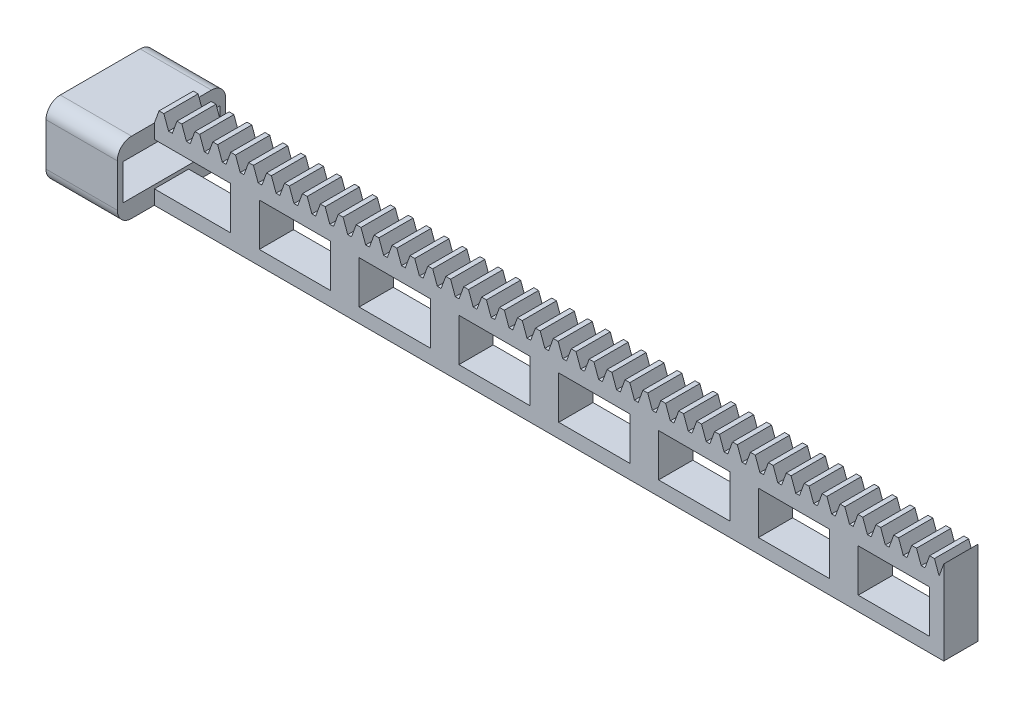
from build123d import *

# Parameters (mm, degrees)
SKETCH_1_W               = 125.663706144
SKETCH_1_H               = 10
EXTRUDE_1_DEPTH          = 30
EXTRUDE_2_DEPTH          = 30
PATTERN_LINEAR_1_COUNT   = 20
PATTERN_LINEAR_1_PITCH   = 6.283185307
CUT_EXTRUDE_1_DEPTH      = 22
CUT_EXTRUDE_2_REACH      = 128.315
CUT_EXTRUDE_3_REACH      = 246.059
CUT_EXTRUDE_6_REACH      = 484.653
SKETCH_7_W               = 207.345115137
SKETCH_7_H               = 14.578468588
CUT_EXTRUDE_7_REACH      = 552.426
SKETCH_9_W               = 278.972656916
SKETCH_9_H               = 19.040254303
SKETCH_10_W              = 8
SKETCH_10_H              = 15
EXTRUDE_1_2_DEPTH        = 276.776278088
SKETCH_11_W              = 38
SKETCH_11_H              = 25
SKETCH_11_R              = 1.25
EXTRUDE_2_2_DEPTH        = 25
CUT_EXTRUDE_9_DEPTH      = 279.853201725
CUT_EXTRUDE_9_DEPTH_BACK = 279.853201725
SKETCH_12_W              = 25
SKETCH_12_H              = 15
CUT_EXTRUDE_10_REACH     = 280.853
SKETCH_13_W              = 1.776278088
SKETCH_13_H              = 15
SKETCH_14_W              = 34
SKETCH_14_H              = 12.5
CUT_EXTRUDE_11_DEPTH     = 20
CUT_EXTRUDE_12_REACH     = 305.682
SKETCH_15_W              = 23.5
SKETCH_15_H              = 12.5
FILLET_1_R               = 5
SKETCH_20_W              = 25
SKETCH_20_H              = 15
EXTRUDE_5_DEPTH          = 2
EXTRUDE_START            = -8
SKETCH_20_2_W            = 25
SKETCH_20_2_H            = 15
EXTRUDE_6_DEPTH          = 2


with BuildPart() as part:
    # 草图1 → Extrude 1 (new body)
    with BuildSketch(Plane.XY):
        with Locations((62.831853072, -5)):
            Rectangle(SKETCH_1_W, SKETCH_1_H)
    extrude(amount=EXTRUDE_1_DEPTH)

    # 草图2 → Extrude 2 (add)
    with BuildSketch(Plane.XY.offset(30)):
        Polygon((0, 0), (1.637866054, 4.5), (3.323577771, 4.5), (4.961443825, 0), align=None)
    extrude_2 = extrude(amount=-EXTRUDE_2_DEPTH)

    # 阵列(线性)1: Extrude 2 ×20
    with Locations(*[(i * PATTERN_LINEAR_1_PITCH, 0, 0) for i in range(1, PATTERN_LINEAR_1_COUNT)]):
        add(extrude_2)

    # 草图3 → 切除-拉伸1 (cut)
    with BuildSketch(Plane.XY.offset(30)):
        Polygon((0, 0), (0, -10), (125.663706144, -10), (125.663706144, 0), (124.341964661, 0), (122.704098607, 4.5), (121.018386891, 4.5), (119.380520836, 0), (118.058779354, 0), (116.4209133, 4.5), (114.735201583, 4.5), (113.097335529, 0), (111.775594047, 0), (110.137727993, 4.5), (108.452016276, 4.5), (106.814150222, 0), (105.49240874, 0), (103.854542686, 4.5), (102.168830969, 4.5), (100.530964915, 0), (99.209223433, 0), (97.571357378, 4.5), (95.885645662, 4.5), (94.247779608, 0), (92.926038125, 0), (91.288172071, 4.5), (89.602460355, 4.5), (87.964594301, 0), (86.642852818, 0), (85.004986764, 4.5), (83.319275048, 4.5), (81.681408993, 0), (80.359667511, 0), (78.721801457, 4.5), (77.03608974, 4.5), (75.398223686, 0), (74.076482204, 0), (72.43861615, 4.5), (70.752904433, 4.5), (69.115038379, 0), (67.793296897, 0), (66.155430843, 4.5), (64.469719126, 4.5), (62.831853072, 0), (61.51011159, 0), (59.872245535, 4.5), (58.186533819, 4.5), (56.548667765, 0), (55.226926282, 0), (53.589060228, 4.5), (51.903348512, 4.5), (50.265482457, 0), (48.943740975, 0), (47.305874921, 4.5), (45.620163204, 4.5), (43.98229715, 0), (42.660555668, 0), (41.022689614, 4.5), (39.336977897, 4.5), (37.699111843, 0), (36.377370361, 0), (34.739504307, 4.5), (33.05379259, 4.5), (31.415926536, 0), (30.094185054, 0), (28.456318999, 4.5), (26.770607283, 4.5), (25.132741229, 0), (23.810999746, 0), (22.173133692, 4.5), (20.487421976, 4.5), (18.849555922, 0), (17.527814439, 0), (15.889948385, 4.5), (14.204236669, 4.5), (12.566370614, 0), (11.244629132, 0), (9.606763078, 4.5), (7.921051361, 4.5), (6.283185307, 0), (4.961443825, 0), (3.323577771, 4.5), (1.637866054, 4.5), align=None)
    extrude(amount=-CUT_EXTRUDE_1_DEPTH, mode=Mode.SUBTRACT)

    # 草图4 → 切除-拉伸2 (cut, up to next)
    with BuildSketch(Plane(origin=(0, 0, 0), x_dir=(-1, 0, 0), z_dir=(0, 0, -1)), mode=Mode.PRIVATE) as cut_extrude_2_sk1:
        Polygon((-121.861242749, 4.5), (-121.861242749, -10), (-125.663706144, -10), (-125.663706144, 0), (-124.341964661, 0), (-122.704098607, 4.5), align=None)
    cut_extrude_2_tool1 = extrude(cut_extrude_2_sk1.sketch, amount=-CUT_EXTRUDE_2_REACH, mode=Mode.PRIVATE) & part.part
    add(cut_extrude_2_tool1.solids().sort_by_distance((123.597626, -3.869254, 0))[0], mode=Mode.SUBTRACT)

    # 镜向1: part across plane


with BuildPart() as part_1:
    add(part.part)
    add(part.part.mirror(Plane(origin=(121.861242749, 4.5, 8.001025), x_dir=(0, 0, 1), z_dir=(-1, 0, 0))))

    # 草图5 → 切除-拉伸3 (cut, up to next)
    with BuildSketch(Plane(origin=(0, 0, 0), x_dir=(-1, 0, 0), z_dir=(0, 0, -1)), mode=Mode.PRIVATE) as cut_extrude_3_sk1:
        Polygon((-241.241763585, 4.5), (-241.241763585, -10), (-243.722485498, -10), (-243.722485498, 0), (-242.084619444, 4.5), align=None)
    cut_extrude_3_tool1 = extrude(cut_extrude_3_sk1.sketch, amount=-CUT_EXTRUDE_3_REACH, mode=Mode.PRIVATE) & part_1.part
    add(cut_extrude_3_tool1.solids().sort_by_distance((242.402862, -3.406333, 0))[0], mode=Mode.SUBTRACT)

    # 镜向2: part across plane


with BuildPart() as part_2:
    add(part_1.part)
    add(part_1.part.mirror(Plane(origin=(241.241763585, 4.5, 8.001025), x_dir=(0, 0, 1), z_dir=(-1, 0, 0))))

    # 草图7 → 切除-拉伸6 (cut, up to next)
    with BuildSketch(Plane(origin=(0, 0, 0), x_dir=(-1, 0, 0), z_dir=(0, 0, -1)), mode=Mode.PRIVATE) as cut_extrude_6_sk1:
        with Locations((-378.810969602, -2.710765706)):
            Rectangle(SKETCH_7_W, SKETCH_7_H)
    cut_extrude_6_tool1 = extrude(cut_extrude_6_sk1.sketch, amount=-CUT_EXTRUDE_6_REACH, mode=Mode.PRIVATE) & part_2.part
    add(cut_extrude_6_tool1.solids().sort_by_distance((378.81097, -2.710766, 0))[0], mode=Mode.SUBTRACT)

    # 镜向4: part across plane


with BuildPart() as part_3:
    add(part_2.part)
    add(part_2.part.mirror(Plane(origin=(275.138412034, 4.578468588, 8.001025), x_dir=(0, 0, 1), z_dir=(-1, 0, 0))))

    # 草图9 → 切除-拉伸7 (cut, up to next)
    with BuildSketch(Plane(origin=(0, 0, 0), x_dir=(-1, 0, 0), z_dir=(0, 0, -1)), mode=Mode.PRIVATE) as cut_extrude_7_sk1:
        with Locations((-416.262606546, -4.273704806)):
            Rectangle(SKETCH_9_W, SKETCH_9_H)
    cut_extrude_7_tool1 = extrude(cut_extrude_7_sk1.sketch, amount=-CUT_EXTRUDE_7_REACH, mode=Mode.PRIVATE) & part_3.part
    add(cut_extrude_7_tool1.solids().sort_by_distance((416.262607, -4.273705, 0))[0], mode=Mode.SUBTRACT)

    # 草图10 → Extrude 1 2 (add)
    with BuildSketch(Plane.ZY):
        with Locations((4, -17.5)):
            Rectangle(SKETCH_10_W, SKETCH_10_H)
    extrude(amount=-EXTRUDE_1_2_DEPTH)

    # 草图11 → Extrude 2 2 (add)
    with BuildSketch(Plane.ZY):
        with Locations((4, -12.5)):
            Rectangle(SKETCH_11_W, SKETCH_11_H)
        with Locations(Location((-10, -16, 0), (0, 0, 270))):
            Circle(SKETCH_11_R, mode=Mode.SUBTRACT)
        with Locations(Location((-10, -9, 0), (0, 0, 270))):
            Circle(SKETCH_11_R, mode=Mode.SUBTRACT)
        with Locations(Location((18, -9, 0), (0, 0, 270))):
            Circle(SKETCH_11_R, mode=Mode.SUBTRACT)
        with Locations(Location((18, -16, 0), (0, 0, 270))):
            Circle(SKETCH_11_R, mode=Mode.SUBTRACT)
    extrude(amount=EXTRUDE_2_2_DEPTH)

    # 草图12 → 切除-拉伸9 (cut, two sides: drawn at the far end of the back side and taken through both)
    with BuildSketch(Plane(origin=(0, 0, 0), x_dir=(-1, 0, 0), z_dir=(0, 0, -1)).offset(-CUT_EXTRUDE_9_DEPTH_BACK)):
        with Locations((-259.276278088, -12.5)):
            Rectangle(SKETCH_12_W, SKETCH_12_H)
        with Locations((-224.276278088, -12.5)):
            Rectangle(SKETCH_12_W, SKETCH_12_H)
        with Locations((-189.276278088, -12.5)):
            Rectangle(SKETCH_12_W, SKETCH_12_H)
        with Locations((-154.276278088, -12.5)):
            Rectangle(SKETCH_12_W, SKETCH_12_H)
        with Locations((-119.276278088, -12.5)):
            Rectangle(SKETCH_12_W, SKETCH_12_H)
        with Locations((-84.276278088, -12.5)):
            Rectangle(SKETCH_12_W, SKETCH_12_H)
        with Locations((-49.276278088, -12.5)):
            Rectangle(SKETCH_12_W, SKETCH_12_H)
        with Locations((-14.276278088, -12.5)):
            Rectangle(SKETCH_12_W, SKETCH_12_H)
    extrude(amount=CUT_EXTRUDE_9_DEPTH + CUT_EXTRUDE_9_DEPTH_BACK, mode=Mode.SUBTRACT)

    # 草图13 → 切除-拉伸10 (cut, up to next)
    with BuildSketch(Plane(origin=(0, 0, 0), x_dir=(-1, 0, 0), z_dir=(0, 0, -1)), mode=Mode.PRIVATE) as cut_extrude_10_sk1:
        with Locations((-0.888139044, -12.5)):
            Rectangle(SKETCH_13_W, SKETCH_13_H)
    cut_extrude_10_tool1 = extrude(cut_extrude_10_sk1.sketch, amount=-CUT_EXTRUDE_10_REACH, mode=Mode.PRIVATE) & part_3.part
    add(cut_extrude_10_tool1.solids().sort_by_distance((0.888139, -12.5, 0))[0], mode=Mode.SUBTRACT)

    # 草图14 → 切除-拉伸11 (cut)
    with BuildSketch(Plane(origin=(0, 0, 0), x_dir=(0, 0, -1), z_dir=(1, 0, 0))):
        with Locations((-4, -12.5)):
            Rectangle(SKETCH_14_W, SKETCH_14_H)
    extrude(amount=-CUT_EXTRUDE_11_DEPTH, mode=Mode.SUBTRACT)

    # 草图15 → 切除-拉伸12 (cut, up to next)
    with BuildSketch(Plane.ZY.offset(25), mode=Mode.PRIVATE) as cut_extrude_12_sk1:
        with Locations((4, -12.5)):
            Rectangle(SKETCH_15_W, SKETCH_15_H)
    cut_extrude_12_tool1 = extrude(cut_extrude_12_sk1.sketch, amount=-CUT_EXTRUDE_12_REACH, mode=Mode.PRIVATE) & part_3.part
    add(cut_extrude_12_tool1.solids().sort_by_distance((-25, -12.5, 4))[0], mode=Mode.SUBTRACT)

    # 圆角1
    fillet_1_edges = [part_3.edges().sort_by_distance(p)[0] for p in [
        (-12.5, 0, -15),
        (-12.5, -25, -15),
        (-12.5, -25, 23),
        (-12.5, 0, 23),
    ]]
    fillet(fillet_1_edges, radius=FILLET_1_R)

    # 草图20 → 凸台-拉伸5 (add)
    with BuildSketch(Plane(origin=(0, 0, 0), x_dir=(-1, 0, 0), z_dir=(0, 0, -1))):
        Polygon((-26.776278088, -5), (0, -5), (0, 0), (-1.637866054, 4.5), (-3.323577771, 4.5), (-4.961443825, 0), (-6.283185307, 0), (-7.921051361, 4.5), (-9.606763078, 4.5), (-11.244629132, 0), (-12.566370614, 0), (-14.204236669, 4.5), (-15.889948385, 4.5), (-17.527814439, 0), (-18.849555922, 0), (-20.487421976, 4.5), (-22.173133692, 4.5), (-23.810999746, 0), (-25.132741229, 0), (-26.770607283, 4.5), (-28.456318999, 4.5), (-30.094185054, 0), (-31.415926536, 0), (-33.05379259, 4.5), (-34.739504307, 4.5), (-36.377370361, 0), (-37.699111843, 0), (-39.336977897, 4.5), (-41.022689614, 4.5), (-42.660555668, 0), (-43.98229715, 0), (-45.620163204, 4.5), (-47.305874921, 4.5), (-48.943740975, 0), (-50.265482457, 0), (-51.903348512, 4.5), (-53.589060228, 4.5), (-55.226926282, 0), (-56.548667765, 0), (-58.186533819, 4.5), (-59.872245535, 4.5), (-61.51011159, 0), (-62.831853072, 0), (-64.469719126, 4.5), (-66.155430843, 4.5), (-67.793296897, 0), (-69.115038379, 0), (-70.752904433, 4.5), (-72.43861615, 4.5), (-74.076482204, 0), (-75.398223686, 0), (-77.03608974, 4.5), (-78.721801457, 4.5), (-80.359667511, 0), (-81.681408993, 0), (-83.319275048, 4.5), (-85.004986764, 4.5), (-86.642852818, 0), (-87.964594301, 0), (-89.602460355, 4.5), (-91.288172071, 4.5), (-92.926038125, 0), (-94.247779608, 0), (-95.885645662, 4.5), (-97.571357378, 4.5), (-99.209223433, 0), (-100.530964915, 0), (-102.168830969, 4.5), (-103.854542686, 4.5), (-105.49240874, 0), (-106.814150222, 0), (-108.452016276, 4.5), (-110.137727993, 4.5), (-111.775594047, 0), (-113.097335529, 0), (-114.735201583, 4.5), (-116.4209133, 4.5), (-118.058779354, 0), (-119.380520836, 0), (-121.018386891, 4.5), (-122.704098607, 4.5), (-124.341964661, 0), (-125.663706144, 0), (-127.301572198, 4.5), (-128.987283914, 4.5), (-130.625149969, 0), (-131.946891451, 0), (-133.584757505, 4.5), (-135.270469222, 4.5), (-136.908335276, 0), (-138.230076758, 0), (-139.867942812, 4.5), (-141.553654529, 4.5), (-143.191520583, 0), (-144.513262065, 0), (-146.151128119, 4.5), (-147.836839836, 4.5), (-149.47470589, 0), (-150.796447372, 0), (-152.434313427, 4.5), (-154.120025143, 4.5), (-155.757891197, 0), (-157.07963268, 0), (-158.717498734, 4.5), (-160.40321045, 4.5), (-162.041076504, 0), (-163.362817987, 0), (-165.000684041, 4.5), (-166.686395757, 4.5), (-168.324261812, 0), (-169.646003294, 0), (-171.283869348, 4.5), (-172.969581065, 4.5), (-174.607447119, 0), (-175.929188601, 0), (-177.567054655, 4.5), (-179.252766372, 4.5), (-180.890632426, 0), (-182.212373908, 0), (-183.850239962, 4.5), (-185.535951679, 4.5), (-187.173817733, 0), (-188.495559215, 0), (-190.13342527, 4.5), (-191.819136986, 4.5), (-193.45700304, 0), (-194.778744523, 0), (-196.416610577, 4.5), (-198.102322293, 4.5), (-199.740188348, 0), (-201.06192983, 0), (-202.699795884, 4.5), (-204.3855076, 4.5), (-206.023373655, 0), (-207.345115137, 0), (-208.982981191, 4.5), (-210.668692908, 4.5), (-212.306558962, 0), (-213.628300444, 0), (-215.266166498, 4.5), (-216.951878215, 4.5), (-218.589744269, 0), (-219.911485751, 0), (-221.549351805, 4.5), (-223.235063522, 4.5), (-224.872929576, 0), (-226.194671058, 0), (-227.832537113, 4.5), (-229.518248829, 4.5), (-231.156114883, 0), (-232.477856366, 0), (-234.11572242, 4.5), (-235.801434136, 4.5), (-237.439300191, 0), (-238.761041673, 0), (-240.398907727, 4.5), (-242.084619444, 4.5), (-243.722485498, 0), (-245.04422698, 0), (-246.682093034, 4.5), (-248.367804751, 4.5), (-250.005670805, 0), (-251.327412287, 0), (-252.965278341, 4.5), (-254.650990058, 4.5), (-256.288856112, 0), (-257.610597594, 0), (-259.248463649, 4.5), (-260.934175365, 4.5), (-262.572041419, 0), (-263.893782902, 0), (-265.531648956, 4.5), (-267.217360672, 4.5), (-268.855226726, 0), (-270.176968209, 0), (-271.814834263, 4.5), (-273.500545979, 4.5), (-275.138412034, 0), (-276.776278088, 4.5), (-276.776278088, -25), (0, -25), (0, -20), (-26.776278088, -20), align=None)
        with Locations((-259.276278088, -12.5)):
            Rectangle(SKETCH_20_W, SKETCH_20_H, mode=Mode.SUBTRACT)
        with Locations((-224.276278088, -12.5)):
            Rectangle(SKETCH_20_W, SKETCH_20_H, mode=Mode.SUBTRACT)
        with Locations((-189.276278088, -12.5)):
            Rectangle(SKETCH_20_W, SKETCH_20_H, mode=Mode.SUBTRACT)
        with Locations((-119.276278088, -12.5)):
            Rectangle(SKETCH_20_W, SKETCH_20_H, mode=Mode.SUBTRACT)
        with Locations((-84.276278088, -12.5)):
            Rectangle(SKETCH_20_W, SKETCH_20_H, mode=Mode.SUBTRACT)
        with Locations((-49.276278088, -12.5)):
            Rectangle(SKETCH_20_W, SKETCH_20_H, mode=Mode.SUBTRACT)
        with Locations((-154.276278088, -12.5)):
            Rectangle(SKETCH_20_W, SKETCH_20_H, mode=Mode.SUBTRACT)
    extrude(amount=EXTRUDE_5_DEPTH)

    # 草图20<2> → 凸台-拉伸6 (add)
    with BuildSketch(Plane(origin=(0, 0, 0), x_dir=(-1, 0, 0), z_dir=(0, 0, -1)).offset(EXTRUDE_START)):
        Polygon((-26.776278088, -5), (0, -5), (0, 0), (-1.637866054, 4.5), (-3.323577771, 4.5), (-4.961443825, 0), (-6.283185307, 0), (-7.921051361, 4.5), (-9.606763078, 4.5), (-11.244629132, 0), (-12.566370614, 0), (-14.204236669, 4.5), (-15.889948385, 4.5), (-17.527814439, 0), (-18.849555922, 0), (-20.487421976, 4.5), (-22.173133692, 4.5), (-23.810999746, 0), (-25.132741229, 0), (-26.770607283, 4.5), (-28.456318999, 4.5), (-30.094185054, 0), (-31.415926536, 0), (-33.05379259, 4.5), (-34.739504307, 4.5), (-36.377370361, 0), (-37.699111843, 0), (-39.336977897, 4.5), (-41.022689614, 4.5), (-42.660555668, 0), (-43.98229715, 0), (-45.620163204, 4.5), (-47.305874921, 4.5), (-48.943740975, 0), (-50.265482457, 0), (-51.903348512, 4.5), (-53.589060228, 4.5), (-55.226926282, 0), (-56.548667765, 0), (-58.186533819, 4.5), (-59.872245535, 4.5), (-61.51011159, 0), (-62.831853072, 0), (-64.469719126, 4.5), (-66.155430843, 4.5), (-67.793296897, 0), (-69.115038379, 0), (-70.752904433, 4.5), (-72.43861615, 4.5), (-74.076482204, 0), (-75.398223686, 0), (-77.03608974, 4.5), (-78.721801457, 4.5), (-80.359667511, 0), (-81.681408993, 0), (-83.319275048, 4.5), (-85.004986764, 4.5), (-86.642852818, 0), (-87.964594301, 0), (-89.602460355, 4.5), (-91.288172071, 4.5), (-92.926038125, 0), (-94.247779608, 0), (-95.885645662, 4.5), (-97.571357378, 4.5), (-99.209223433, 0), (-100.530964915, 0), (-102.168830969, 4.5), (-103.854542686, 4.5), (-105.49240874, 0), (-106.814150222, 0), (-108.452016276, 4.5), (-110.137727993, 4.5), (-111.775594047, 0), (-113.097335529, 0), (-114.735201583, 4.5), (-116.4209133, 4.5), (-118.058779354, 0), (-119.380520836, 0), (-121.018386891, 4.5), (-122.704098607, 4.5), (-124.341964661, 0), (-125.663706144, 0), (-127.301572198, 4.5), (-128.987283914, 4.5), (-130.625149969, 0), (-131.946891451, 0), (-133.584757505, 4.5), (-135.270469222, 4.5), (-136.908335276, 0), (-138.230076758, 0), (-139.867942812, 4.5), (-141.553654529, 4.5), (-143.191520583, 0), (-144.513262065, 0), (-146.151128119, 4.5), (-147.836839836, 4.5), (-149.47470589, 0), (-150.796447372, 0), (-152.434313427, 4.5), (-154.120025143, 4.5), (-155.757891197, 0), (-157.07963268, 0), (-158.717498734, 4.5), (-160.40321045, 4.5), (-162.041076504, 0), (-163.362817987, 0), (-165.000684041, 4.5), (-166.686395757, 4.5), (-168.324261812, 0), (-169.646003294, 0), (-171.283869348, 4.5), (-172.969581065, 4.5), (-174.607447119, 0), (-175.929188601, 0), (-177.567054655, 4.5), (-179.252766372, 4.5), (-180.890632426, 0), (-182.212373908, 0), (-183.850239962, 4.5), (-185.535951679, 4.5), (-187.173817733, 0), (-188.495559215, 0), (-190.13342527, 4.5), (-191.819136986, 4.5), (-193.45700304, 0), (-194.778744523, 0), (-196.416610577, 4.5), (-198.102322293, 4.5), (-199.740188348, 0), (-201.06192983, 0), (-202.699795884, 4.5), (-204.3855076, 4.5), (-206.023373655, 0), (-207.345115137, 0), (-208.982981191, 4.5), (-210.668692908, 4.5), (-212.306558962, 0), (-213.628300444, 0), (-215.266166498, 4.5), (-216.951878215, 4.5), (-218.589744269, 0), (-219.911485751, 0), (-221.549351805, 4.5), (-223.235063522, 4.5), (-224.872929576, 0), (-226.194671058, 0), (-227.832537113, 4.5), (-229.518248829, 4.5), (-231.156114883, 0), (-232.477856366, 0), (-234.11572242, 4.5), (-235.801434136, 4.5), (-237.439300191, 0), (-238.761041673, 0), (-240.398907727, 4.5), (-242.084619444, 4.5), (-243.722485498, 0), (-245.04422698, 0), (-246.682093034, 4.5), (-248.367804751, 4.5), (-250.005670805, 0), (-251.327412287, 0), (-252.965278341, 4.5), (-254.650990058, 4.5), (-256.288856112, 0), (-257.610597594, 0), (-259.248463649, 4.5), (-260.934175365, 4.5), (-262.572041419, 0), (-263.893782902, 0), (-265.531648956, 4.5), (-267.217360672, 4.5), (-268.855226726, 0), (-270.176968209, 0), (-271.814834263, 4.5), (-273.500545979, 4.5), (-275.138412034, 0), (-276.776278088, 4.5), (-276.776278088, -25), (0, -25), (0, -20), (-26.776278088, -20), align=None)
        with Locations((-259.276278088, -12.5)):
            Rectangle(SKETCH_20_2_W, SKETCH_20_2_H, mode=Mode.SUBTRACT)
        with Locations((-224.276278088, -12.5)):
            Rectangle(SKETCH_20_2_W, SKETCH_20_2_H, mode=Mode.SUBTRACT)
        with Locations((-189.276278088, -12.5)):
            Rectangle(SKETCH_20_2_W, SKETCH_20_2_H, mode=Mode.SUBTRACT)
        with Locations((-119.276278088, -12.5)):
            Rectangle(SKETCH_20_2_W, SKETCH_20_2_H, mode=Mode.SUBTRACT)
        with Locations((-84.276278088, -12.5)):
            Rectangle(SKETCH_20_2_W, SKETCH_20_2_H, mode=Mode.SUBTRACT)
        with Locations((-49.276278088, -12.5)):
            Rectangle(SKETCH_20_2_W, SKETCH_20_2_H, mode=Mode.SUBTRACT)
        with Locations((-154.276278088, -12.5)):
            Rectangle(SKETCH_20_2_W, SKETCH_20_2_H, mode=Mode.SUBTRACT)
    extrude(amount=-EXTRUDE_6_DEPTH)


solid = part_3.part
